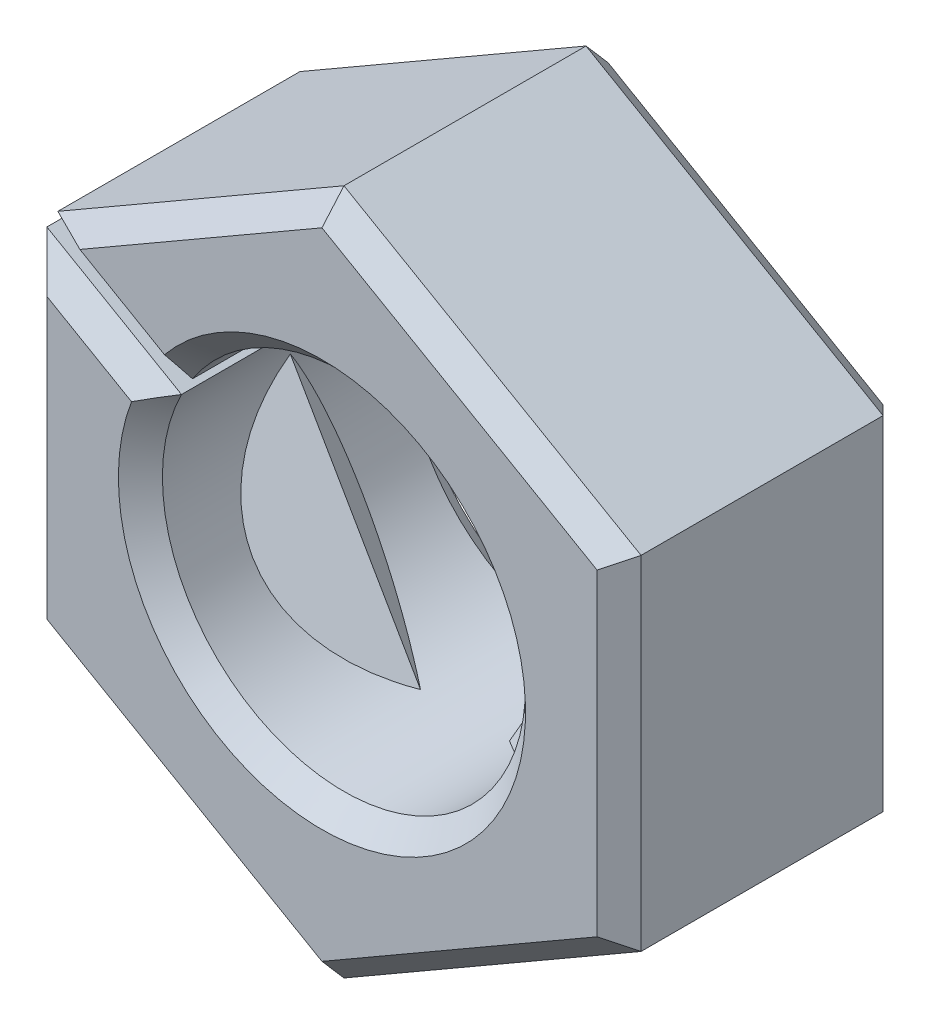
from build123d import *

# Parameters (mm, degrees)
SKETCH1_R              = 1.65
BOSS_EXTRUDE1_DEPTH    = 1.3
CLIP_REACH             = 6.324
CLIP_DIRECTION_2_REACH = 6.324
CLIPS_X3_COUNT         = 3
SPLIT_2_DEPTH          = 5.324349662
SPLIT_2_DEPTH_BACK     = 5.324349662
DEBURS_SIZE            = 0.2


with BuildPart() as part:
    # Sketch1 → Boss-Extrude1 (new, symmetric)
    with BuildSketch(Plane.XY):
        Polygon((2.7, -1.558845727), (2.7, 1.558845727), (0, 3.117691454), (-2.7, 1.558845727), (-2.7, -1.558845727), (0, -3.117691454), align=None)
        Circle(SKETCH1_R, mode=Mode.SUBTRACT)
    extrude(amount=BOSS_EXTRUDE1_DEPTH, both=True)

    # Sketch3 → Clip (add, up to next)
    with BuildSketch(Plane(origin=(0, 0, 0), x_dir=(0, 0, -1), z_dir=(1, 0, 0)), mode=Mode.PRIVATE) as clip_sk1:
        Polygon((-0.5, 1.65), (0.5, 1.65), (0, 1.15), align=None)
    clip_tool1 = extrude(clip_sk1.sketch, amount=CLIP_REACH, mode=Mode.PRIVATE) - part.part
    clip = clip_tool1.solids().sort_by_distance((0, 1.483333, 0))[0]
    add(clip)

    # Sketch3 → Clip direction 2 (add, up to next)
    with BuildSketch(Plane(origin=(0, 0, 0), x_dir=(0, 0, -1), z_dir=(1, 0, 0)), mode=Mode.PRIVATE) as clip_direction_2_sk1:
        Polygon((-0.5, 1.65), (0.5, 1.65), (0, 1.15), align=None)
    clip_direction_2_tool1 = extrude(clip_direction_2_sk1.sketch, amount=-CLIP_DIRECTION_2_REACH, mode=Mode.PRIVATE) - part.part
    clip_direction_2 = clip_direction_2_tool1.solids().sort_by_distance((0, 1.483333, 0))[0]
    add(clip_direction_2)

    # Clips x3: Clip, Clip direction 2 ×3 about axis
    clips_x3_axis = Axis((0, 0, 1.3), (0, 0, 1))
    add([clip.rotate(clips_x3_axis, i * 360 / CLIPS_X3_COUNT) for i in range(1, CLIPS_X3_COUNT)])
    add([clip_direction_2.rotate(clips_x3_axis, i * 360 / CLIPS_X3_COUNT) for i in range(1, CLIPS_X3_COUNT)])

    # Sketch4 → Split 2 (cut, two sides: drawn at the far end of the back side and taken through both)
    with BuildSketch(Plane.XY.offset(-SPLIT_2_DEPTH_BACK)):
        Polygon((-2.75, 1.472243186), (-0.05, -0.08660254), (0.05, 0.08660254), (-2.65, 1.645448267), align=None)
    extrude(amount=SPLIT_2_DEPTH + SPLIT_2_DEPTH_BACK, mode=Mode.SUBTRACT)

    # Deburs
    deburs_edges = [part.edges().sort_by_distance(p)[0] for p in [
        (-0.378536622, -1.605991913, -1.3),
        (2.7, 0, -1.3),
        (1.35, 2.33826859, -1.3),
        (-1.3, 2.367136104, -1.3),
        (-2.7, -0.057735027, -1.3),
        (-1.35, -2.33826859, -1.3),
        (1.35, -2.33826859, -1.3),
        (-0.378536622, -1.605991913, 1.3),
        (-1.35, -2.33826859, 1.3),
        (-2.7, -0.057735027, 1.3),
        (-1.3, 2.367136104, 1.3),
        (1.35, 2.33826859, 1.3),
        (2.7, 0, 1.3),
        (1.35, -2.33826859, 1.3),
        (-1.988157591, 1.263333374, -1.3),
        (-2.088157591, 1.090128294, -1.3),
        (-1.988157591, 1.263333374, 1.3),
        (-2.088157591, 1.090128294, 1.3),
    ]]
    chamfer(deburs_edges, length=DEBURS_SIZE)


solid = part.part
